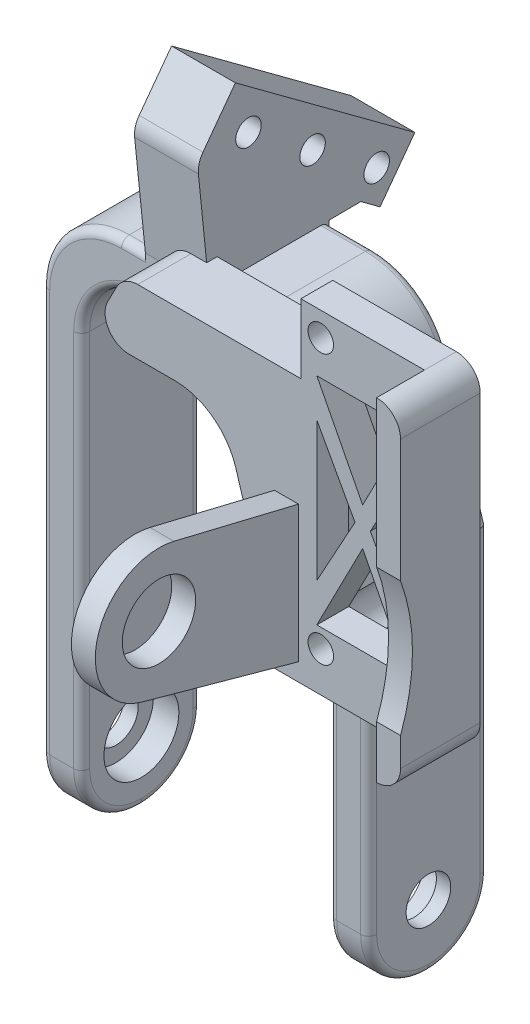
from build123d import *

# Parameters (mm, degrees)
SKETCH_1_W                  = 41
SKETCH_1_H                  = 15
EXTRUDE_1_DEPTH             = 68
CUT_EXTRUDE_1_DEPTH         = 74.654599313
FILLET_1_R                  = 8
FILLET_3_R                  = 7.5
SKETCH_4_R                  = 2.8
CUT_EXTRUDE_2_DEPTH         = 80.757444794
SKETCH_6_R                  = 4.7
CUT_EXTRUDE_4_DEPTH         = 3.2
SKETCH_7_R                  = 1.6
EXTRUDE_2_DEPTH             = 4
CHAMFER_1_SIZE              = 3
CHAMFER_1_SIZE2             = 5
FILLET_4_R                  = 10
FILLET_2_R                  = 1
EXTRUDE_9_DEPTH             = 3
SKETCH_9_W                  = 15.5
SKETCH_9_H                  = 41.8
SKETCH_9_R                  = 1.6
EXTRUDE_3_DEPTH             = 4
EXTRUDE_5_REACH             = 85.051
EXTRUDE_5_DIRECTION_2_DEPTH = 4
SKETCH_11_W                 = 3
SKETCH_11_H                 = 41.8
EXTRUDE_6_DEPTH             = 10
SKETCH_13_R                 = 3
CUT_EXTRUDE_5_DEPTH         = 10
CUT_EXTRUDE_6_REACH         = 93.697
SKETCH_14_R                 = 24.25
FILLET_START                = 6.5
FILLET_5_DEPTH              = 8
FILLET_5_2_DEPTH            = 4
FILLET_START_2              = 7.652859874
FILLET_5_3_DEPTH            = 6.847140126
FILLET_START_3              = -5
FILLET_5_4_DEPTH            = 24
FILLET_START_4              = -0.804471856
FILLET_5_5_DEPTH            = 3.959511856
FILLET_START_5              = -4.0000001
FILLET_5_6_DEPTH            = 6.0000001
FILLET_START_6              = 10
FILLET_5_7_DEPTH            = 10.5
SKETCH_15_R                 = 4.6
EXTRUDE_7_DEPTH             = 3


with BuildPart() as part:
    # 草图1 → 凸台-拉伸1 (new body)
    with BuildSketch(Plane(origin=(0, 0, 0), x_dir=(1, 0, 0), z_dir=(0, 1, 0))):
        with Locations((3.5, 0)):
            Rectangle(SKETCH_1_W, SKETCH_1_H)
    extrude(amount=-EXTRUDE_1_DEPTH)

    # 草图3 → 切除-拉伸1 (cut, through all)
    with BuildSketch(Plane.XY.offset(7.5)):
        Polygon((-12, -68), (19, -68), (19, -25.914294311), (12.608731909, -5), (-12, -5), align=None)
        Polygon((17, 0), (27.489114219, -34.323770918), (27.489114219, 0), align=None)
    extrude(amount=-CUT_EXTRUDE_1_DEPTH, mode=Mode.SUBTRACT)

    # 圆角1
    fillet_1_edges = [part.edges().sort_by_distance(p)[0] for p in [
        (-12, -5, 0),
        (12.608731909, -5, 0),
        (19, -25.914294311, 0),
    ]]
    fillet(fillet_1_edges, radius=FILLET_1_R)

    # 圆角3
    fillet_3_edges = [part.edges().sort_by_distance(p)[0] for p in [
        (21.5, -68, -7.5),
        (21.5, -68, 7.5),
        (-14.5, -68, -7.5),
        (-14.5, -68, 7.5),
    ]]
    fillet(fillet_3_edges, radius=FILLET_3_R - 0.0001)  # a hair under: the kernel refuses the full size

    # 草图4 → 切除-拉伸2 (cut, through all)
    with BuildSketch(Plane(origin=(24, 0, 0), x_dir=(0, 0, -1), z_dir=(1, 0, 0))):
        with Locations((0, -60)):
            Circle(SKETCH_4_R)
    extrude(amount=-CUT_EXTRUDE_2_DEPTH, mode=Mode.SUBTRACT)

    # 草图6 → 切除-拉伸4 (cut)
    with BuildSketch(Plane(origin=(19, 0, 0), x_dir=(0, 0, -1), z_dir=(1, 0, 0))):
        with Locations((0, -60)):
            Circle(SKETCH_6_R)
    cut_extrude_4 = extrude(amount=CUT_EXTRUDE_4_DEPTH, mode=Mode.SUBTRACT)

    # 镜向2: 切除-拉伸4 across plane
    add(cut_extrude_4.mirror(Plane(origin=(3.5, 0, 0), x_dir=(0, 0, 1), z_dir=(1, 0, 0))), mode=Mode.SUBTRACT)

    # 草图7 → 凸台-拉伸2 (add, symmetric)
    with BuildSketch(Plane(origin=(0, 0, 0), x_dir=(0, 0, -1), z_dir=(1, 0, 0))):
        Polygon((-4.21542005, 20.860912491), (-8.971140622, 14.427941029), (-7.5, 0), (7.5, 0), (7.5, 3.064442774), (13.932971462, -1.691277798), (18.299980069, 4.215890487), align=None)
        with Locations((13.509755484, 2.782799971)):
            Circle(SKETCH_7_R, mode=Mode.SUBTRACT)
        with Locations((5.468541156, 8.727450686)):
            Circle(SKETCH_7_R, mode=Mode.SUBTRACT)
        with Locations((-2.572673172, 14.672101402)):
            Circle(SKETCH_7_R, mode=Mode.SUBTRACT)
    extrude(amount=EXTRUDE_2_DEPTH, both=True)

    # 倒角1
    chamfer_1_edges = [part.edges().sort_by_distance(p)[0] for p in [
        (0, 3.064442774, -7.5),
    ]]
    chamfer_1_side = [part.faces().sort_by_distance(p)[0] for p in [
        (-12.756402743, -36.75005, -7.5),
    ]]
    chamfer(chamfer_1_edges, length=CHAMFER_1_SIZE, length2=CHAMFER_1_SIZE2, reference=chamfer_1_side[0])

    # 圆角4
    fillet_4_edges = [part.edges().sort_by_distance(p)[0] for p in [
        (17, 0, 0),
        (-17, 0, 0),
    ]]
    fillet(fillet_4_edges, radius=FILLET_4_R)

    # 圆角2
    fillet_2_edges = [part.edges().sort_by_distance(p)[0] for p in [
        (6.799708487, 0, 7.5),
        (-5.5, 0, -7.5),
        (21.581415909, -14.991873182, -7.5),
        (21.581415909, -14.991873182, 7.5),
        (-5.5, 0, 7.5),
        (-14.071067812, -2.928932188, 7.5),
        (15.548149847, -1.961805102, 7.5),
        (6.799708487, 0, -7.5),
        (-14.071067812, -2.928932188, -7.5),
        (15.548149847, -1.961805102, -7.5),
        (16.49486462, -17.716681899, 7.5),
        (16.49486462, -17.716681899, -7.5),
        (1.344132744, -5, 7.5),
        (1.344132744, -5, -7.5),
        (-12, -36.75005, 7.5),
        (-12, -36.75005, -7.5),
        (18.912201179, -25.927410294, 7.5),
        (18.912201179, -25.927410294, -7.5),
        (11.447251786, -6.569444081, 7.5),
        (11.447251786, -6.569444081, -7.5),
        (-9.656854249, -7.343145751, 7.5),
        (-9.656854249, -7.343145751, -7.5),
        (24, -41.703180904, -7.5),
        (19, -43.804744254, -7.5),
        (-17, -35.25005, -7.5),
        (19, -43.804744254, 7.5),
        (19, -65.803330148, 5.303330148),
        (19, -65.803330148, -5.303330148),
        (24, -41.703180904, 7.5),
        (24, -65.803330148, 5.303330148),
        (24, -65.803330148, -5.303330148),
        (-17, -35.25005, 7.5),
        (-17, -65.803330148, 5.303330148),
        (-17, -65.803330148, -5.303330148),
        (-12, -65.803330148, 5.303330148),
        (-12, -65.803330148, -5.303330148),
    ]]
    fillet(fillet_2_edges, radius=FILLET_2_R)

    # 草图16 → 凸台-拉伸9 (add, symmetric)
    with BuildSketch(Plane.XY.offset(7.5)):
        with BuildLine():
            Line((6.688265489, -5), (4, -5))
            Line((4, -5), (4, 0))
            Line((4, 0), (9.599416975, 0))
            ThreePointArc((9.599416975, 0), (15.548149847, -1.961805102), (19.162831819, -7.077484556))
            Line((19.162831819, -7.077484556), (24, -22.906261808))
            Line((24, -22.906261808), (24, -32.19186866))
            Line((24, -32.19186866), (19, -32.19186866))
            Line((19, -32.19186866), (19, -27.109388508))
            ThreePointArc((19, -27.109388508), (18.912201179, -25.927410294), (18.650731875, -24.771376153))
            Line((18.650731875, -24.771376153), (14.338997364, -10.661987644))
            ThreePointArc((14.338997364, -10.661987644), (11.447251786, -6.569444081), (6.688265489, -5))
        make_face()
    extrude(amount=EXTRUDE_9_DEPTH, both=True)


with BuildPart() as body_2:
    # 草图9 → 凸台-拉伸3 (new body)
    with BuildSketch(Plane(origin=(0, 5.628221735, 10.5), x_dir=(1, 0, 0), z_dir=(0, 0, 1))):
        with Locations((30.25, -14.728221735)):
            Rectangle(SKETCH_9_W, SKETCH_9_H)
        with Locations((25, 3.171778265)):
            Circle(SKETCH_9_R, mode=Mode.SUBTRACT)
        with Locations((25, -30.628221735)):
            Circle(SKETCH_9_R, mode=Mode.SUBTRACT)
        Polygon((30.25, -12.362507958), (24.501570259, -1.196565922), (35.998429741, -1.196565922), align=None, mode=Mode.SUBTRACT)
        Polygon((35.998429741, -28.259877548), (30.25, -17.093935512), (24.501570259, -28.259877548), align=None, mode=Mode.SUBTRACT)
        Polygon((29.288779045, -14.728221735), (24.501570259, -6.007487482), (24.501570259, -23.448955989), align=None, mode=Mode.SUBTRACT)
        Polygon((35.998429741, -6.007487482), (35.998429741, -23.448955989), (31.211220955, -14.728221735), align=None, mode=Mode.SUBTRACT)
    extrude(amount=EXTRUDE_3_DEPTH)

    # 凸台-拉伸5: up to this face of the body (flat: up to its plane)
    extrude_5_end = Plane(body_2.part.faces().sort_by_distance((30.451087866, -9.138302451, 14.5))[0])
    # 草图10 → 凸台-拉伸5 (add, up to the picked face)
    with BuildSketch(Plane.XY.offset(10.5), mode=Mode.PRIVATE) as extrude_5_sk1:
        with BuildLine():
            Line((0.21802001, 3.115631229), (-4, -5))
            Line((-4, -5), (6.688265489, -5))
            ThreePointArc((6.688265489, -5), (11.447251786, -6.569444081), (14.338997364, -10.661987644))
            Line((14.338997364, -10.661987644), (18.650731875, -24.771376153))
            ThreePointArc((18.650731875, -24.771376153), (18.912201179, -25.927410294), (19, -27.109388508))
            Line((19, -27.109388508), (19, -30))
            Line((19, -30), (22.5, -30))
            Line((22.5, -30), (22.5, 3.115631229))
            Line((22.5, 3.115631229), (0.21802001, 3.115631229))
        make_face()
    extrude_5_tool1 = split(extrude(extrude_5_sk1.sketch, amount=EXTRUDE_5_REACH, mode=Mode.PRIVATE), bisect_by=extrude_5_end, keep=Keep.BOTH, mode=Mode.PRIVATE)

    add(part.part)  # 凸台-拉伸5 merges part
    add(extrude_5_tool1.solids().sort_by(Axis((14.08393, -7.198348, 10.5), (0, 0, 1)))[0])

    # 草图10 → 凸台-拉伸5 direction 2 (add)
    with BuildSketch(Plane.XY.offset(10.5)):
        with BuildLine():
            Line((0.21802001, 3.115631229), (-4, -5))
            Line((-4, -5), (6.688265489, -5))
            ThreePointArc((6.688265489, -5), (11.447251786, -6.569444081), (14.338997364, -10.661987644))
            Line((14.338997364, -10.661987644), (18.650731875, -24.771376153))
            ThreePointArc((18.650731875, -24.771376153), (18.912201179, -25.927410294), (19, -27.109388508))
            Line((19, -27.109388508), (19, -30))
            Line((19, -30), (22.5, -30))
            Line((22.5, -30), (22.5, 3.115631229))
            Line((22.5, 3.115631229), (0.21802001, 3.115631229))
        make_face()
    extrude(amount=-EXTRUDE_5_DIRECTION_2_DEPTH)

    # 草图11 → 凸台-拉伸6 (add)
    with BuildSketch(Plane(origin=(0, 0, 10.5), x_dir=(-1, 0, 0), z_dir=(0, 0, -1))):
        with Locations((-39.5, -9.1)):
            Rectangle(SKETCH_11_W, SKETCH_11_H)
    extrude(amount=-EXTRUDE_6_DEPTH)

    # 草图13 → 切除-拉伸5 (cut)
    with BuildSketch(Plane(origin=(0, 0, 10.5), x_dir=(-1, 0, 0), z_dir=(0, 0, -1))):
        with Locations((-25, -25)):
            Circle(SKETCH_13_R)
    extrude(amount=CUT_EXTRUDE_5_DEPTH, mode=Mode.SUBTRACT)

    # 草图14 → 切除-拉伸6 (cut, up to next)
    with BuildSketch(Plane(origin=(41, 0, 0), x_dir=(0, 0, -1), z_dir=(1, 0, 0)), mode=Mode.PRIVATE) as cut_extrude_6_sk1:
        with Locations((-43.25, -15)):
            Circle(SKETCH_14_R)
    cut_extrude_6_tool1 = extrude(cut_extrude_6_sk1.sketch, amount=-CUT_EXTRUDE_6_REACH, mode=Mode.PRIVATE) & body_2.part
    add(cut_extrude_6_tool1.solids().sort_by_distance((41, -15, 43.25))[0], mode=Mode.SUBTRACT)

    # 圆角5: read off the stored shape, not the designer's step
    # 圆角5 outline → 圆角5 (cut)
    with BuildSketch(Plane.XY.offset(FILLET_START)):
        with BuildLine():
            Line((-4, -5), (0.94022188, -5))
            ThreePointArc((0.94022188, -5), (-1.624007204, -3.557154201), (-1.721711514, -0.616486136))
            Line((-1.721711514, -0.616486136), (-4, -5))
        make_face()
    extrude(amount=FILLET_5_DEPTH, mode=Mode.SUBTRACT)

    # Fillet 5 2 outline → Fillet 5 2 (cut)
    with BuildSketch(Plane.XY.offset(FILLET_START)):
        with BuildLine():
            Line((22.5, 3.115631229), (19.5, 3.115631229))
            ThreePointArc((19.5, 3.115631229), (21.621320343, 2.236951573), (22.5, 0.115631229))
            Line((22.5, 0.115631229), (22.5, 3.115631229))
        make_face()
    extrude(amount=FILLET_5_2_DEPTH, mode=Mode.SUBTRACT)

    # Fillet 5 3 outline → Fillet 5 3 (cut)
    with BuildSketch(Plane.XY.offset(FILLET_START_2)):
        with BuildLine():
            Line((0.21802001, 3.115631229), (-0.62213286, 1.499145092))
            ThreePointArc((-0.62213286, 1.499145092), (0.482646332, 2.679860313), (2.039800533, 3.115631229))
            Line((2.039800533, 3.115631229), (0.21802001, 3.115631229))
        make_face()
    extrude(amount=FILLET_5_3_DEPTH, mode=Mode.SUBTRACT)

    # Fillet 5 4 outline → Fillet 5 4 (cut)
    with BuildSketch(Plane.YZ.offset(FILLET_START_3)):
        with BuildLine():
            Line((14.427941029, 8.971140622), (13.27341905, 8.85342014))
            ThreePointArc((13.27341905, 8.85342014), (14.370679619, 8.762204174), (15.361130486, 8.281259076))
            Line((15.361130486, 8.281259076), (14.427941029, 8.971140622))
        make_face()
    extrude(amount=FILLET_5_4_DEPTH, mode=Mode.SUBTRACT)

    # Fillet 5 5 outline → Fillet 5 5 (add)
    with BuildSketch(Plane.YZ.offset(FILLET_START_4)):
        Polygon((3.115631229, 7.652859874), (3.115631229, 7.817684391), (1.499145092, 7.652859874), align=None)
    extrude(amount=FILLET_5_5_DEPTH)

    # Fillet 5 6 outline → Fillet 5 6 (add)
    with BuildSketch(Plane.YZ.offset(FILLET_START_5)):
        with BuildLine():
            Line((1, 7.500000003), (-4, 7.5))
            ThreePointArc((-4, 7.5), (-4.707106781, 7.207106781), (-5, 6.5))
            Line((-5, 6.5), (1, 6.5))
            Line((1, 6.5), (1, 7.500000003))
        make_face()
    extrude(amount=FILLET_5_6_DEPTH)

    # Fillet 5 7 outline → Fillet 5 7 (cut)
    with BuildSketch(Plane.XY.offset(FILLET_START_6)):
        with BuildLine():
            ThreePointArc((38, 11.8), (40.121320344, 10.921320344), (41, 8.8))
            Line((41, 8.8), (40.999999981, 11.8))
            Line((40.999999981, 11.8), (38, 11.8))
        make_face()
        with BuildLine():
            Line((40.999999981, -30), (41, -27))
            ThreePointArc((41, -27), (40.121320344, -29.121320344), (38, -30))
            Line((38, -30), (40.999999981, -30))
        make_face()
    extrude(amount=FILLET_5_7_DEPTH, mode=Mode.SUBTRACT)

    # 草图15 → 凸台-拉伸7 (add)
    with BuildSketch(Plane.ZY.offset(-22.2)):
        with BuildLine():
            Line((14.5, -27.788500248), (34.133534465, -22.345942708))
            ThreePointArc((34.133534465, -22.345942708), (39.730978267, -12.644276282), (30.12382269, -6.886128118))
            Line((30.12382269, -6.886128118), (14.5, -10.661987644))
            Line((14.5, -10.661987644), (14.5, -27.788500248))
        make_face()
        with Locations(Location((32, -14.64940994, 0), (0, 0, 270))):
            Circle(SKETCH_15_R, mode=Mode.SUBTRACT)
    extrude(amount=EXTRUDE_7_DEPTH)


solid = body_2.part
